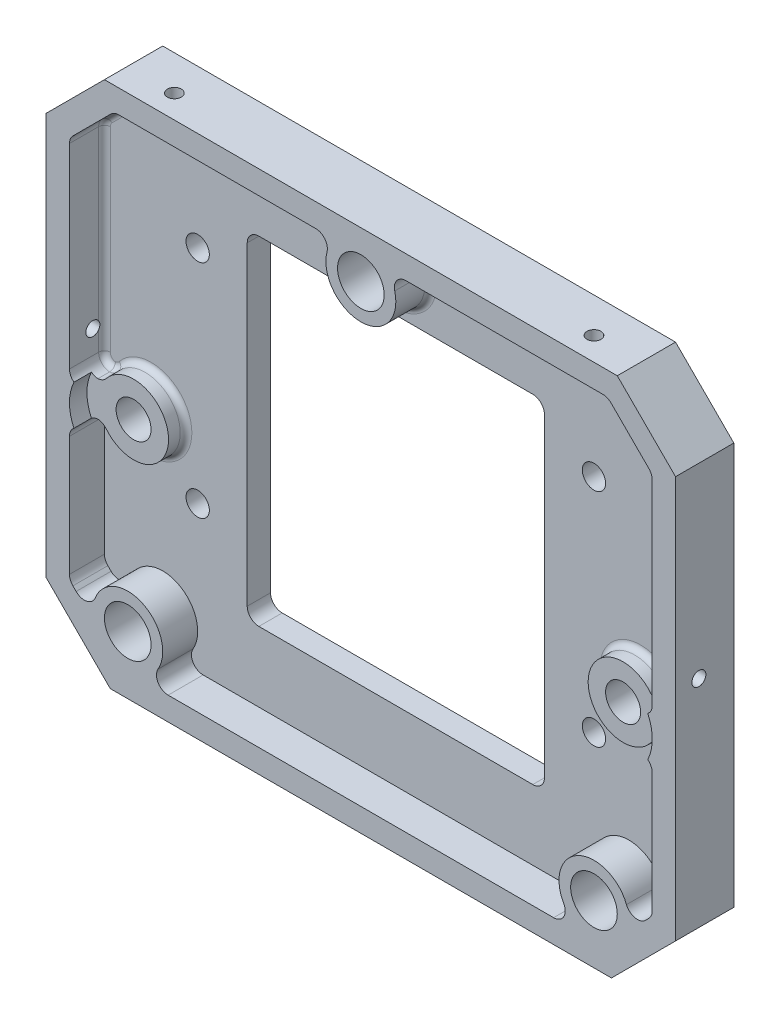
from build123d import *

# Parameters (mm, degrees)
SKETCH_1_R                = 2
SKETCH_1_R_2              = 1.5
EXTRUDE_1_DEPTH           = 2
BOSS_EXTRUDE1_OUTLINE_R   = 2
BOSS_EXTRUDE1_OUTLINE_R_2 = 1.5
BOSS_EXTRUDE1_DEPTH       = 3
SKETCH3_R                 = 1
CUT_EXTRUDE2_DEPTH        = 2
FILLET2_R                 = 1
FILLET3_R                 = 0.5
SKETCH4_R                 = 4
CUT_EXTRUDE3_DEPTH        = 1.5
SKETCH5_R                 = 0.6
CUT_EXTRUDE4_DEPTH        = 2.5
SKETCH6_R                 = 0.6
CUT_EXTRUDE5_DEPTH        = 65


# Read off the part's stored shape, not the designer's step: Boss-Extrude1
with BuildPart() as part:
    # 草图1 → 凸台-拉伸1 (new body)
    with BuildSketch(Plane.XY):
        Polygon((-27, 1.5), (-27, -6.5), (-21.5, -12), (-15.5, -12), (15.5, -12), (21.5, -12), (27, -6.5), (27, 1.5), (27, 25), (27, 28), (22, 33), (-22, 33), (-27, 28), (-27, 25), align=None)
        with Locations((20, -7)):
            Circle(SKETCH_1_R, mode=Mode.SUBTRACT)
        with Locations((0, 29)):
            Circle(SKETCH_1_R, mode=Mode.SUBTRACT)
        with Locations(Location((-20, -7, 0), (0, 0, 180))):
            Circle(SKETCH_1_R, mode=Mode.SUBTRACT)
        with Locations((-21, 7.5)):
            Circle(SKETCH_1_R_2, mode=Mode.SUBTRACT)
        with Locations(Location((21, 7.5, 0), (0, 0, 180))):
            Circle(SKETCH_1_R_2, mode=Mode.SUBTRACT)
        with BuildLine():
            Line((-12.75, 24), (-12.75, -3))
            ThreePointArc((-12.75, -3), (-12.457106781, -3.707106781), (-11.75, -4))
            Line((-11.75, -4), (11.75, -4))
            ThreePointArc((11.75, -4), (12.457106781, -3.707106781), (12.75, -3))
            Line((12.75, -3), (12.75, 24))
            ThreePointArc((12.75, 24), (12.457106781, 24.707106781), (11.75, 25))
            Line((11.75, 25), (-11.75, 25))
            ThreePointArc((-11.75, 25), (-12.457106781, 24.707106781), (-12.75, 24))
        make_face(mode=Mode.SUBTRACT)
    extrude(amount=EXTRUDE_1_DEPTH)

    # Boss-Extrude1 outline → Boss-Extrude1 (add)
    with BuildSketch(Plane.XY.offset(2)):
        Polygon((-21.5, -12), (21.5, -12), (27, -6.5), (27, 28), (22, 33), (-22, 33), (-27, 28), (-27, -6.5), align=None)
        with Locations((-20, -7)):
            Circle(BOSS_EXTRUDE1_OUTLINE_R, mode=Mode.SUBTRACT)
        with Locations((-21, 7.5)):
            Circle(BOSS_EXTRUDE1_OUTLINE_R_2, mode=Mode.SUBTRACT)
        with Locations((20, -7)):
            Circle(BOSS_EXTRUDE1_OUTLINE_R, mode=Mode.SUBTRACT)
        with Locations((21, 7.5)):
            Circle(BOSS_EXTRUDE1_OUTLINE_R_2, mode=Mode.SUBTRACT)
        with BuildLine():
            Line((25, 6), (25, -5.671572875))
            Line((25, -5.671572875), (24.429255588, -6.242317287))
            ThreePointArc((24.429255588, -6.242317287), (23.518347202, -6.514222715), (22.791611605, -5.90140788))
            ThreePointArc((22.791611605, -5.90140788), (18.697105438, -4.297692512), (17.401923789, -8.5))
            ThreePointArc((17.401923789, -8.5), (17.401923789, -9.5), (16.535898385, -10))
            Line((16.535898385, -10), (-16.535898385, -10))
            ThreePointArc((-16.535898385, -10), (-17.401923789, -9.5), (-17.401923789, -8.5))
            ThreePointArc((-17.401923789, -8.5), (-18.697105438, -4.297692512), (-22.791611605, -5.90140788))
            ThreePointArc((-22.791611605, -5.90140788), (-23.518347202, -6.514222715), (-24.429255588, -6.242317287))
            Line((-24.429255588, -6.242317287), (-25, -5.671572875))
            Line((-25, -5.671572875), (-25, 6))
            Line((-25, 6), (-23.598076211, 6))
            ThreePointArc((-23.598076211, 6), (-18, 7.5), (-23.598076211, 9))
            Line((-23.598076211, 9), (-25, 9))
            Line((-25, 9), (-25, 27.171572875))
            Line((-25, 27.171572875), (-21.171572875, 31))
            Line((-21.171572875, 31), (-3.872983346, 31))
            ThreePointArc((-3.872983346, 31), (-3.082413931, 30.612372436), (-2.90473751, 29.75))
            ThreePointArc((-2.90473751, 29.75), (0, 26), (2.90473751, 29.75))
            ThreePointArc((2.90473751, 29.75), (3.082413931, 30.612372436), (3.872983346, 31))
            Line((3.872983346, 31), (21.171572875, 31))
            Line((21.171572875, 31), (25, 27.171572875))
            Line((25, 27.171572875), (25, 9))
            Line((25, 9), (23.598076211, 9))
            ThreePointArc((23.598076211, 9), (18, 7.5), (23.598076211, 6))
            Line((23.598076211, 6), (25, 6))
        make_face(mode=Mode.SUBTRACT)
        with Locations((0, 29)):
            Circle(BOSS_EXTRUDE1_OUTLINE_R, mode=Mode.SUBTRACT)
    extrude(amount=BOSS_EXTRUDE1_DEPTH)

    # Sketch3 → Cut-Extrude2 (cut)
    with BuildSketch(Plane(origin=(0, 0, 0), x_dir=(-1, 0, 0), z_dir=(0, 0, -1))):
        with Locations((-17, 21.5)):
            Circle(SKETCH3_R)
        with Locations((-17, 2.5)):
            Circle(SKETCH3_R)
        with Locations(Location((17, 2.5, 0), (0, 0, 180))):
            Circle(SKETCH3_R)
        with Locations(Location((17, 21.5, 0), (0, 0, 180))):
            Circle(SKETCH3_R)
    extrude(amount=-CUT_EXTRUDE2_DEPTH, mode=Mode.SUBTRACT)

    # Fillet2
    # the kernel refuses this fillet: 1 mm, written as the material it adds along each edge
    with BuildSketch(Plane(origin=(25, -5.671572875, 0.964466094), x_dir=(0, 1, 0), z_dir=(0, 0, 1)), Plane(origin=(21.171572875, 31, 0.964466094), x_dir=(-1, 0, 0), z_dir=(0, 0, 1)), Plane(origin=(-25, 27.171572875, 0.964466094), x_dir=(0, -1, 0), z_dir=(0, 0, 1)), Plane(origin=(-21.171572875, 31, 0.964466094), x_dir=(-0.7071067811865432, -0.7071067811865518, 0), z_dir=(0, 0, 1)), Plane(origin=(-25, -5.671572875, 0.964466094), x_dir=(0.7071067811865432, -0.7071067811865518, 0), z_dir=(0, 0, 1)), Plane(origin=(25, 27.171572875, 0.964466094), x_dir=(-0.7071067811865475, 0.7071067811865475, 0), z_dir=(0, 0, 1))) as fillet2_piece_1:
        with BuildLine():
            CenterArc((FILLET2_R * 0.414213562373, FILLET2_R), FILLET2_R, 225, 45)
            Line((-FILLET2_R * 0.292893218813, FILLET2_R * 0.292893218813), (0, 0))
            Line((0, 0), (FILLET2_R * 0.414213562373, 0))
        make_face()
    extrude(amount=4.035533906)
    with BuildSketch(Plane(origin=(23.598076211, 9, 0.68894303), x_dir=(1, 0, 0), z_dir=(0, 0, 1)), Plane(origin=(-23.598076211, 6, 0.68894303), x_dir=(-1, 0, 0), z_dir=(0, 0, 1))) as fillet2_piece_2:
        with BuildLine():
            CenterArc((0.524422788, 1), FILLET2_R, 218.682187455, 51.317812545)
            ThreePointArc((-0.256201962, 0.375), (-0.120994483, 0.192355197), (0, 0))
            Line((0, 0), (0.524422788, 0))
        make_face()
    extrude(amount=4.31105697)
    with BuildSketch(Plane(origin=(25, 9, 2), x_dir=(0, 1, 0), z_dir=(0, 0, 1)), Plane(origin=(25, 6, 2), x_dir=(-1, 0, 0), z_dir=(0, 0, 1)), Plane(origin=(-25, 6, 2), x_dir=(0, -1, 0), z_dir=(0, 0, 1)), Plane(origin=(-25, 9, 2), x_dir=(1, 0, 0), z_dir=(0, 0, 1))) as fillet2_piece_3:
        with BuildLine():
            CenterArc((FILLET2_R, FILLET2_R), FILLET2_R, 180, 90)
            Line((0, FILLET2_R), (0, 0))
            Line((0, 0), (FILLET2_R, 0))
        make_face()
    extrude(amount=3)
    with BuildSketch(Plane(origin=(23.598076211, 6, 0.68894303), x_dir=(1, 0, 0), z_dir=(0, 0, 1))) as fillet2_piece_4:
        with BuildLine():
            CenterArc((0.524422788, -1), FILLET2_R, 90, 51.317812545)
            ThreePointArc((-0.256201962, -0.375), (-0.120994483, -0.192355197), (0, 0))
            Line((0, 0), (0.524422788, 0))
        make_face()
    extrude(amount=4.31105697)
    with BuildSketch(Plane(origin=(-23.598076211, 9, 0.68894303), x_dir=(0.5641183988802636, 0.8256939094148436, 0), z_dir=(0, 0, 1))) as fillet2_piece_5:
        with BuildLine():
            CenterArc((0.529857366, 0.997131101), FILLET2_R, 214.341093729, 51.317812545)
            Line((-0.295836543, 0.433012702), (0, 0))
            ThreePointArc((0, 0), (0.227081728, 0.008606698), (0.454163457, 0))
        make_face()
    extrude(amount=4.31105697)

    # Fillet3
    # the kernel refuses this fillet: 0.5 mm, written as the material it adds along each edge
    with BuildSketch(Plane(origin=(20.757359313, 30, 2), x_dir=(0, 1, 0), z_dir=(-1, 0, 0))) as fillet3_piece_1:
        with BuildLine():
            CenterArc((1 - FILLET3_R, -FILLET3_R), FILLET3_R, 0, 90)
            Line((1 - FILLET3_R, 0), (1, 0))
            Line((1, 0), (1, -FILLET3_R))
        make_face()
    revolve(axis=Axis((20.757359313, 30, 2), (0, 0, -1)), revolution_arc=45)
    with BuildSketch(Plane(origin=(21.464466094, 30.707106781, 2), x_dir=(0, 0, 1), z_dir=(0.7071067811865476, -0.7071067811865476, 0)), Plane(origin=(-24.707106781, 27.464466094, 2), x_dir=(0, 0, 1), z_dir=(0.7071067811865476, 0.7071067811865476, 0))) as fillet3_piece_2:
        with BuildLine():
            CenterArc((FILLET3_R, FILLET3_R), FILLET3_R, 180, 90)
            Line((0, FILLET3_R), (0, 0))
            Line((0, 0), (FILLET3_R, 0))
        make_face()
    extrude(amount=4.585786438)
    with BuildSketch(Plane(origin=(-25, 10, 2), x_dir=(0, 0, 1), z_dir=(0, 1, 0)), Plane(origin=(25, 26.757359313, 2), x_dir=(0, 0, 1), z_dir=(0, -1, 0))) as fillet3_piece_3:
        with BuildLine():
            CenterArc((FILLET3_R, FILLET3_R), FILLET3_R, 180, 90)
            Line((0, FILLET3_R), (0, 0))
            Line((0, 0), (FILLET3_R, 0))
        make_face()
    extrude(amount=16.757359313)
    with BuildSketch(Plane(origin=(-24, 26.757359313, 2), x_dir=(-1, 0, 0), z_dir=(0, -1, 0))) as fillet3_piece_4:
        with BuildLine():
            CenterArc((1 - FILLET3_R, -FILLET3_R), FILLET3_R, 0, 90)
            Line((1 - FILLET3_R, 0), (1, 0))
            Line((1, 0), (1, -FILLET3_R))
        make_face()
    revolve(axis=Axis((-24, 26.757359313, 2), (0, 0, -1)), revolution_arc=45)
    with BuildSketch(Plane(origin=(-20.757359313, 30, 2), x_dir=(-0.7071067811865476, 0.7071067811865476, 0), z_dir=(-0.7071067811865476, -0.7071067811865476, 0))) as fillet3_piece_5:
        with BuildLine():
            CenterArc((1 - FILLET3_R, -FILLET3_R), FILLET3_R, 0, 90)
            Line((1 - FILLET3_R, 0), (1, 0))
            Line((1, 0), (1, -FILLET3_R))
        make_face()
    revolve(axis=Axis((-20.757359313, 30, 2), (0, 0, -1)), revolution_arc=45)
    with BuildSketch(Plane(origin=(-20.757359313, 31, 2), x_dir=(0, 0, 1), z_dir=(1, 0, 0)), Plane(origin=(3.872983346, 31, 2), x_dir=(0, 0, 1), z_dir=(1, 0, 0))) as fillet3_piece_6:
        with BuildLine():
            CenterArc((FILLET3_R, FILLET3_R), FILLET3_R, 180, 90)
            Line((0, FILLET3_R), (0, 0))
            Line((0, 0), (FILLET3_R, 0))
        make_face()
    extrude(amount=16.884375967)
    with BuildSketch(Plane(origin=(-3.872983345, 30.000000001, 2), x_dir=(-6.500027189216223e-10, 1.0, 0), z_dir=(-1.0, -6.500027189216223e-10, 0))) as fillet3_piece_7:
        with BuildLine():
            CenterArc((0.999999999 - FILLET3_R, -FILLET3_R), FILLET3_R, 0, 90)
            Line((0.999999999 - FILLET3_R, 0), (0.999999999, 0))
            Line((0.999999999, 0), (0.999999999, -FILLET3_R))
        make_face()
    revolve(axis=Axis((-3.872983345, 30.000000001, 2), (0, 0, -1)), revolution_arc=104.477512292)
    with BuildSketch(Plane(origin=(0, 29, 2), x_dir=(-0.9682458365805575, 0.24999999988883273, 0), z_dir=(0.24999999988883273, 0.9682458365805575, 0))) as fillet3_piece_8:
        with BuildLine():
            CenterArc((3 + FILLET3_R, FILLET3_R), FILLET3_R, 180, 90)
            Line((3 + FILLET3_R, 0), (3, 0))
            Line((3, 0), (3, FILLET3_R))
        make_face()
    revolve(axis=Axis((0, 29, 2), (0, 0, 1)), revolution_arc=208.955024359)
    with BuildSketch(Plane(origin=(3.872983345, 30.000000001, 2), x_dir=(-0.9682458362513904, -0.2500000011636916, 0), z_dir=(0.2500000011636916, -0.9682458362513904, 0))) as fillet3_piece_9:
        with BuildLine():
            CenterArc((0.999999999 - FILLET3_R, -FILLET3_R), FILLET3_R, 0, 90)
            Line((0.999999999 - FILLET3_R, 0), (0.999999999, 0))
            Line((0.999999999, 0), (0.999999999, -FILLET3_R))
        make_face()
    revolve(axis=Axis((3.872983345, 30.000000001, 2), (0, 0, -1)), revolution_arc=104.477512292)
    with BuildSketch(Plane(origin=(-21, 7.5, 2), x_dir=(-0.9672051356057111, -0.2539965071766504, 0), z_dir=(-0.2539965071766504, 0.9672051356057111, 0))) as fillet3_piece_10:
        with BuildLine():
            CenterArc((3 + FILLET3_R, FILLET3_R), FILLET3_R, 180, 90)
            Line((3 + FILLET3_R, 0), (3, 0))
            Line((3, 0), (3, FILLET3_R))
        make_face()
    revolve(axis=Axis((-21, 7.5, 2), (0, 0, 1)), revolution_arc=306.603680913)
    with BuildSketch(Plane(origin=(21, 7.5, 2), x_dir=(0.780624749779316, 0.6250000000255845, 0), z_dir=(0.6250000000255845, -0.780624749779316, 0))) as fillet3_piece_11:
        with BuildLine():
            CenterArc((3 + FILLET3_R, FILLET3_R), FILLET3_R, 180, 90)
            Line((3 + FILLET3_R, 0), (3, 0))
            Line((3, 0), (3, FILLET3_R))
        make_face()
    revolve(axis=Axis((21, 7.5, 2), (0, 0, 1)), revolution_arc=306.603680913)
    with BuildSketch(Plane(origin=(24, 10, 2), x_dir=(-0.9280623468327948, -0.37242486543087544, 0), z_dir=(-0.37242486543087544, 0.9280623468327948, 0))) as fillet3_piece_12:
        with BuildLine():
            CenterArc((1 - FILLET3_R, FILLET3_R), FILLET3_R, 270, 90)
            Line((1 - FILLET3_R, 0), (1, 0))
            Line((1, 0), (1, FILLET3_R))
        make_face()
    revolve(axis=Axis((24, 10, 2), (0, 0, 1)), revolution_arc=158.134757045)
    with BuildSketch(Plane(origin=(24.122498999, 10, 2), x_dir=(0.9279423572134511, -0.37272373373471146, 0), z_dir=(0.37272373373471146, 0.9279423572134511, 0))) as fillet3_piece_13:
        with BuildLine():
            CenterArc((1 - FILLET3_R, -FILLET3_R), FILLET3_R, 0, 90)
            Line((1 - FILLET3_R, 0), (1, 0))
            Line((1, 0), (1, -FILLET3_R))
        make_face()
    revolve(axis=Axis((24.122498999, 10, 2), (0, 0, -1)), revolution_arc=119.434117166)
    with BuildSketch(Plane(origin=(-24.122498999, 10, 2), x_dir=(0.7806247497794805, -0.6250000000253787, 0), z_dir=(0.6250000000253787, 0.7806247497794805, 0))) as fillet3_piece_14:
        with BuildLine():
            CenterArc((1 - FILLET3_R, -FILLET3_R), FILLET3_R, 0, 90)
            Line((1 - FILLET3_R, 0), (1, 0))
            Line((1, 0), (1, -FILLET3_R))
        make_face()
    revolve(axis=Axis((-24.122498999, 10, 2), (0, 0, -1)), revolution_arc=119.434117166)
    with BuildSketch(Plane(origin=(-24, 10, 2), x_dir=(-1, 0, 0), z_dir=(0, 1, 0))) as fillet3_piece_15:
        with BuildLine():
            CenterArc((1 - FILLET3_R, FILLET3_R), FILLET3_R, 270, 90)
            Line((1 - FILLET3_R, 0), (1, 0))
            Line((1, 0), (1, FILLET3_R))
        make_face()
    revolve(axis=Axis((-24, 10, 2), (0, 0, 1)), revolution_arc=158.134757045)
    with BuildSketch(Plane(origin=(24, 26.757359313, 2), x_dir=(0.7071067811865476, 0.7071067811865476, 0), z_dir=(-0.7071067811865476, 0.7071067811865476, 0))) as fillet3_piece_16:
        with BuildLine():
            CenterArc((1 - FILLET3_R, -FILLET3_R), FILLET3_R, 0, 90)
            Line((1 - FILLET3_R, 0), (1, 0))
            Line((1, 0), (1, -FILLET3_R))
        make_face()
    revolve(axis=Axis((24, 26.757359313, 2), (0, 0, -1)), revolution_arc=45)

    # Sketch4 → Cut-Extrude3 (cut)
    with BuildSketch(Plane.XY.offset(5)):
        with Locations((-21, 7.5)):
            Circle(SKETCH4_R)
        with Locations((21, 7.5)):
            Circle(SKETCH4_R)
    extrude(amount=-CUT_EXTRUDE3_DEPTH, mode=Mode.SUBTRACT)

    # Sketch5 → Cut-Extrude4 (cut)
    with BuildSketch(Plane(origin=(0, 33, 0), x_dir=(1, 0, 0), z_dir=(0, 1, 0))):
        with Locations(Location((-18, -3, 0), (0, 0, 180))):
            Circle(SKETCH5_R)
        with Locations(Location((18, -3, 0), (0, 0, 123.55730975))):
            Circle(SKETCH5_R)
    extrude(amount=-CUT_EXTRUDE4_DEPTH, mode=Mode.SUBTRACT)

    # Sketch6 → Cut-Extrude5 (cut)
    with BuildSketch(Plane(origin=(27, 0, 0), x_dir=(0, 0, -1), z_dir=(1, 0, 0))):
        with Locations(Location((-3, 12, 0), (0, 0, 33.557309762))):
            Circle(SKETCH6_R)
    extrude(amount=-CUT_EXTRUDE5_DEPTH, mode=Mode.SUBTRACT)


solid = part.part
